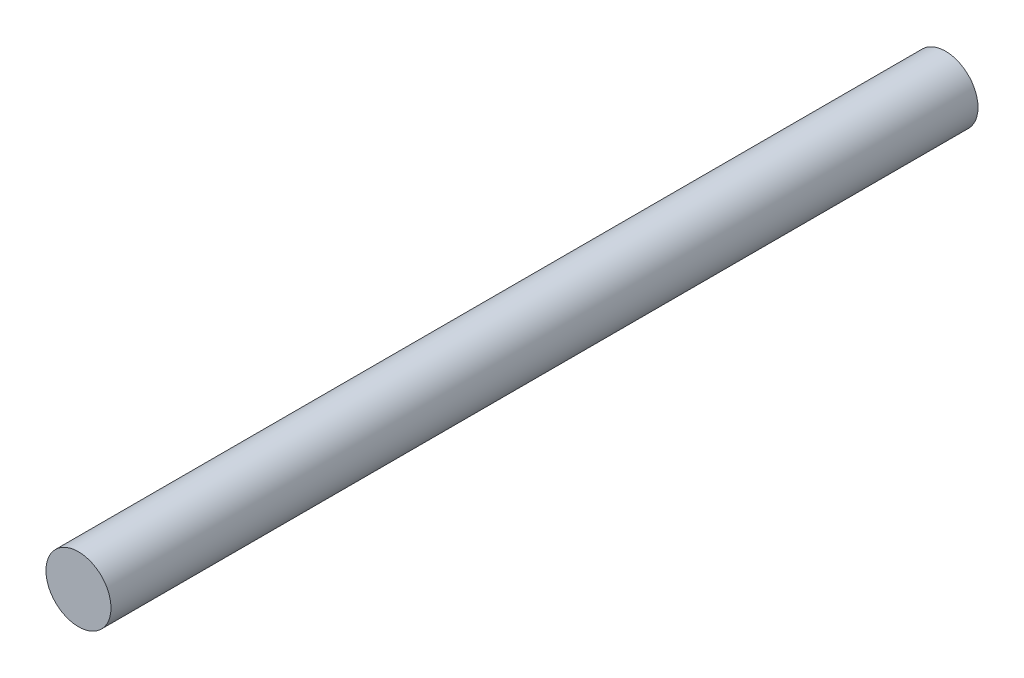
from build123d import *

# Parameters (mm, degrees)
BOSS_EXTRUDE1_DEPTH      = 40
BOSS_EXTRUDE1_DEPTH_BACK = 40
SKETCH1_R                = 3


with BuildPart() as part:
    # Sketch1 → Boss-Extrude1 (new, two sides: drawn at the far end of the back side and taken through both)
    with BuildSketch(Plane.XY.offset(-BOSS_EXTRUDE1_DEPTH_BACK)):
        Circle(SKETCH1_R)
    extrude(amount=BOSS_EXTRUDE1_DEPTH + BOSS_EXTRUDE1_DEPTH_BACK)


solid = part.part
